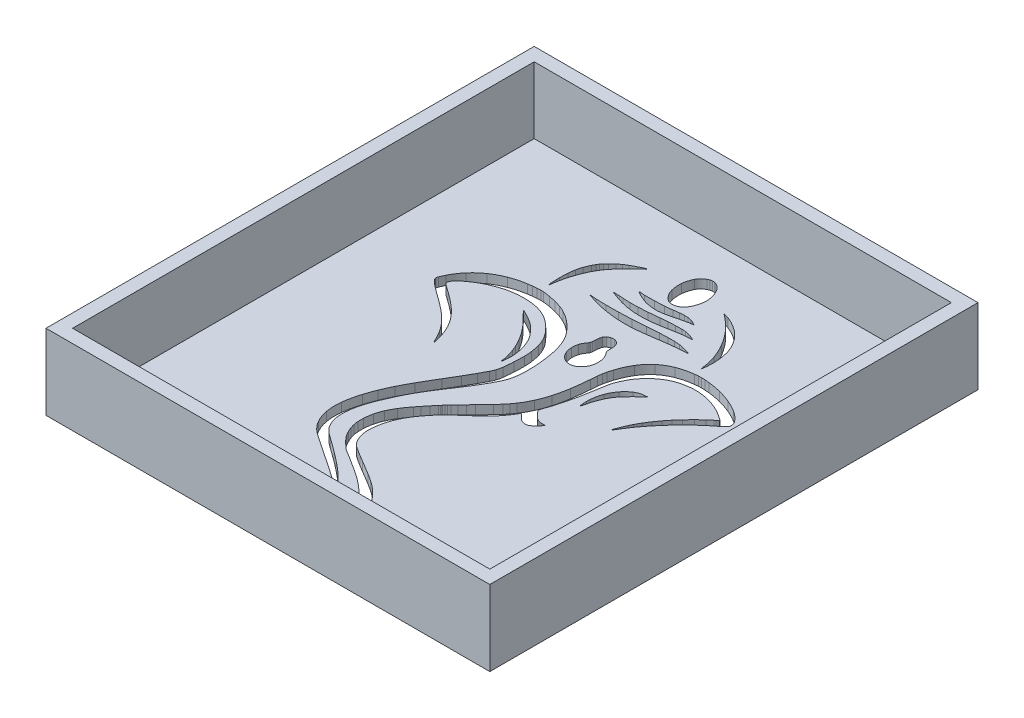
from build123d import *

# Parameters (mm, degrees)
SKETCH1_W           = 100
SKETCH1_H           = 110
BOSS_EXTRUDE1_DEPTH = 2
SKETCH2_W           = 100
SKETCH2_H           = 110
SKETCH2_W_2         = 94
SKETCH2_H_2         = 104
BOSS_EXTRUDE2_DEPTH = 15
CUT_EXTRUDE1_REACH  = 78.25


with BuildPart() as part:
    # Sketch1 → Boss-Extrude1 (new body)
    with BuildSketch(Plane(origin=(0, 0, 0), x_dir=(1, 0, 0), z_dir=(0, 1, 0))):
        Rectangle(SKETCH1_W, SKETCH1_H)
    extrude(amount=BOSS_EXTRUDE1_DEPTH)

    # Sketch2 → Boss-Extrude2 (add)
    with BuildSketch(Plane(origin=(0, 2, 0), x_dir=(1, 0, 0), z_dir=(0, 1, 0))):
        Rectangle(SKETCH2_W, SKETCH2_H)
        Rectangle(SKETCH2_W_2, SKETCH2_H_2, mode=Mode.SUBTRACT)
    extrude(amount=BOSS_EXTRUDE2_DEPTH)

    # Sketch4 → Cut-Extrude1 (cut, up to next)
    with BuildSketch(Plane.XZ, mode=Mode.PRIVATE) as cut_extrude1_sk1:
        with BuildLine():
            Line((9.47406283, -38.48205929), (9.186502871, -38.710567713))
            ThreePointArc((9.186502871, -38.710567713), (9.061127474, -38.810454253), (8.935859828, -38.910475889))
            Line((8.935859828, -38.910475889), (8.720966167, -39.082401533))
            ThreePointArc((8.720966167, -39.082401533), (8.701265352, -39.098574144), (8.681963789, -39.115221219))
            ThreePointArc((8.681963789, -39.115221219), (8.673841503, -39.149940797), (8.703931389, -39.169072429))
            ThreePointArc((8.703931389, -39.169072429), (8.835052241, -39.157032449), (8.964756587, -39.134351582))
            ThreePointArc((8.964756587, -39.134351582), (9.177241087, -39.083197749), (9.387226765, -39.022597482))
            ThreePointArc((9.387226765, -39.022597482), (9.618887581, -38.945980889), (9.847963596, -38.861951041))
            ThreePointArc((9.847963596, -38.861951041), (11.535345038, -38.060130076), (13.082006416, -37.012269601))
            ThreePointArc((13.082006416, -37.012269601), (14.366185015, -35.791117436), (15.414278841, -34.362192449))
            ThreePointArc((15.414278841, -34.362192449), (16.20745254, -32.748508351), (16.708772989, -31.021725594))
            ThreePointArc((16.708772989, -31.021725594), (16.951045093, -29.100879838), (16.92313547, -27.165016919))
            ThreePointArc((16.92313547, -27.165016919), (16.901767061, -26.922364591), (16.878710814, -26.679866815))
            ThreePointArc((16.878710814, -26.679866815), (16.856996364, -26.471223992), (16.8330174, -26.262829284))
            ThreePointArc((16.8330174, -26.262829284), (16.811073616, -26.083560944), (16.788481027, -25.904373214))
            ThreePointArc((16.788481027, -25.904373214), (16.780874967, -25.879048728), (16.765492792, -25.857541276))
            ThreePointArc((16.765492792, -25.857541276), (16.751967667, -25.853842622), (16.741901162, -25.863603488))
            ThreePointArc((16.741901162, -25.863603488), (16.723648308, -25.92995185), (16.707244629, -25.996781418))
            ThreePointArc((16.707244629, -25.996781418), (16.687972911, -26.087141776), (16.671726951, -26.178094854))
            ThreePointArc((16.671726951, -26.178094854), (16.654566841, -26.290792017), (16.63942931, -26.403778631))
            ThreePointArc((16.63942931, -26.403778631), (16.335956708, -28.071664455), (15.848751479, -29.695416224))
            ThreePointArc((15.848751479, -29.695416224), (15.159372662, -31.352193642), (14.317389157, -32.936876053))
            ThreePointArc((14.317389157, -32.936876053), (13.302288717, -34.482580887), (12.150488486, -35.929297364))
            ThreePointArc((12.150488486, -35.929297364), (10.870394389, -37.26661251), (9.47406283, -38.48205929))
        make_face()
    cut_extrude1_tool1 = extrude(cut_extrude1_sk1.sketch, amount=-CUT_EXTRUDE1_REACH, mode=Mode.PRIVATE) & part.part
    # Sketch4 → Cut-Extrude1 (cut, up to next)
    with BuildSketch(Plane.XZ, mode=Mode.PRIVATE) as cut_extrude1_sk2:
        with BuildLine():
            Line((6.941908645, -33.890231102), (7.347396509, -33.63349437))
            Line((7.347396509, -33.63349437), (6.682513669, -33.547278241))
            ThreePointArc((6.682513669, -33.547278241), (6.495755061, -33.519621548), (6.310117562, -33.485235657))
            ThreePointArc((6.310117562, -33.485235657), (5.980249226, -33.4167065), (5.650884261, -33.345797511))
            ThreePointArc((5.650884261, -33.345797511), (5.267883689, -33.260361312), (4.88554578, -33.172006876))
            ThreePointArc((4.88554578, -33.172006876), (4.494561137, -33.078617079), (4.10424883, -32.982456022))
            ThreePointArc((4.10424883, -32.982456022), (3.064972223, -32.730835391), (2.022007288, -32.494969))
            ThreePointArc((2.022007288, -32.494969), (1.377525276, -32.374570327), (0.726958013, -32.293236815))
            ThreePointArc((0.726958013, -32.293236815), (0.180911967, -32.264428695), (-0.365642362, -32.280998453))
            ThreePointArc((-0.365642362, -32.280998453), (-1.010096289, -32.343671348), (-1.650588241, -32.438638787))
            ThreePointArc((-1.650588241, -32.438638787), (-1.939627621, -32.494465595), (-2.226408456, -32.560927228))
            ThreePointArc((-2.226408456, -32.560927228), (-2.505925043, -32.636957254), (-2.782285059, -32.723762949))
            ThreePointArc((-2.782285059, -32.723762949), (-3.072160528, -32.826875564), (-3.358130333, -32.940371246))
            ThreePointArc((-3.358130333, -32.940371246), (-3.678434514, -33.078908573), (-3.995210868, -33.225332956))
            ThreePointArc((-3.995210868, -33.225332956), (-4.424467866, -33.434126517), (-4.850606808, -33.649212371))
            ThreePointArc((-4.850606808, -33.649212371), (-5.063207174, -33.771041314), (-5.263834116, -33.911718382))
            ThreePointArc((-5.263834116, -33.911718382), (-5.282854734, -33.963617278), (-5.244237135, -34.003164216))
            ThreePointArc((-5.244237135, -34.003164216), (-5.125166803, -34.017688038), (-5.005882695, -34.005039454))
            ThreePointArc((-5.005882695, -34.005039454), (-4.504177433, -33.921638979), (-3.996381241, -33.893234125))
            ThreePointArc((-3.996381241, -33.893234125), (-2.921533611, -33.899451845), (-1.846888643, -33.921229742))
            ThreePointArc((-1.846888643, -33.921229742), (-0.734375177, -33.961902929), (0.377220916, -34.022686514))
            ThreePointArc((0.377220916, -34.022686514), (1.208265784, -34.09325946), (2.035604275, -34.198744693))
            ThreePointArc((2.035604275, -34.198744693), (2.720218571, -34.29424366), (3.406484953, -34.377040046))
            ThreePointArc((3.406484953, -34.377040046), (3.924950488, -34.423588025), (4.444926125, -34.448053553))
            ThreePointArc((4.444926125, -34.448053553), (4.858447417, -34.447137789), (5.27127063, -34.423102558))
            ThreePointArc((5.27127063, -34.423102558), (5.622569496, -34.377027368), (5.968415806, -34.300058887))
            ThreePointArc((5.968415806, -34.300058887), (6.092731649, -34.263872269), (6.215501686, -34.222745416))
            ThreePointArc((6.215501686, -34.222745416), (6.352824966, -34.171519866), (6.488681407, -34.116521977))
            ThreePointArc((6.488681407, -34.116521977), (6.618174424, -34.059868444), (6.746037088, -33.99962557))
            ThreePointArc((6.746037088, -33.99962557), (6.845480049, -33.947626957), (6.941908645, -33.890231102))
        make_face()
    cut_extrude1_tool2 = extrude(cut_extrude1_sk2.sketch, amount=-CUT_EXTRUDE1_REACH, mode=Mode.PRIVATE) & part.part
    # Sketch4 → Cut-Extrude1 (cut, up to next)
    with BuildSketch(Plane.XZ, mode=Mode.PRIVATE) as cut_extrude1_sk3:
        with BuildLine():
            Line((6.94346083, -30.262756948), (6.28048446, -30.143500538))
            Line((6.28048446, -30.143500538), (5.45133148, -29.994221067))
            Line((5.45133148, -29.994221067), (4.598784504, -29.840638214))
            Line((4.598784504, -29.840638214), (3.85736083, -29.706973915))
            ThreePointArc((3.85736083, -29.706973915), (2.69248572, -29.523505749), (1.520608375, -29.391983589))
            ThreePointArc((1.520608375, -29.391983589), (0.40620671, -29.321271888), (-0.71036825, -29.308960463))
            ThreePointArc((-0.71036825, -29.308960463), (-1.773760762, -29.354355975), (-2.833045849, -29.45818031))
            ThreePointArc((-2.833045849, -29.45818031), (-3.845116422, -29.617430117), (-4.84544117, -29.838784456))
            ThreePointArc((-4.84544117, -29.838784456), (-5.310482591, -29.964483512), (-5.771442387, -30.104411502))
            ThreePointArc((-5.771442387, -30.104411502), (-6.3177033, -30.284922389), (-6.860600526, -30.475310851))
            ThreePointArc((-6.860600526, -30.475310851), (-7.401400047, -30.672081876), (-7.941167457, -30.871666698))
            ThreePointArc((-7.941167457, -30.871666698), (-7.976140931, -30.912014374), (-7.961100577, -30.963247826))
            ThreePointArc((-7.961100577, -30.963247826), (-7.9398499, -30.977133634), (-7.914811792, -30.981316942))
            ThreePointArc((-7.914811792, -30.981316942), (-7.627069225, -30.969256666), (-7.339346849, -30.956723934))
            ThreePointArc((-7.339346849, -30.956723934), (-7.011133907, -30.940865489), (-6.683055712, -30.922428475))
            ThreePointArc((-6.683055712, -30.922428475), (-6.298052402, -30.898332645), (-5.913171159, -30.872359836))
            ThreePointArc((-5.913171159, -30.872359836), (-5.082695328, -30.827375052), (-4.251216442, -30.808491268))
            ThreePointArc((-4.251216442, -30.808491268), (-3.335250163, -30.812854114), (-2.419640164, -30.838769118))
            ThreePointArc((-2.419640164, -30.838769118), (-1.371504372, -30.891418534), (-0.324649943, -30.96528601))
            ThreePointArc((-0.324649943, -30.96528601), (0.910502777, -31.072693073), (2.144236106, -31.195333162))
            ThreePointArc((2.144236106, -31.195333162), (2.978547054, -31.276250598), (3.814121483, -31.342867135))
            ThreePointArc((3.814121483, -31.342867135), (4.630895387, -31.39339928), (5.448461037, -31.428888963))
            ThreePointArc((5.448461037, -31.428888963), (6.154965004, -31.446493477), (6.861673872, -31.451004573))
            ThreePointArc((6.861673872, -31.451004573), (7.304875913, -31.43430962), (7.74584683, -31.386860478))
            ThreePointArc((7.74584683, -31.386860478), (8.064998505, -31.331979524), (8.380529342, -31.259109764))
            ThreePointArc((8.380529342, -31.259109764), (8.746751357, -31.15662206), (9.109146565, -31.041331094))
            ThreePointArc((9.109146565, -31.041331094), (9.444688504, -30.9236185), (9.777354862, -30.798009021))
            ThreePointArc((9.777354862, -30.798009021), (9.888306215, -30.732411602), (9.972777824, -30.635057756))
            ThreePointArc((9.972777824, -30.635057756), (9.975355907, -30.607064489), (9.954580327, -30.588126569))
            ThreePointArc((9.954580327, -30.588126569), (9.871622097, -30.567334672), (9.787508625, -30.551865511))
            ThreePointArc((9.787508625, -30.551865511), (9.66163943, -30.536122937), (9.535129466, -30.526843289))
            ThreePointArc((9.535129466, -30.526843289), (9.369411273, -30.520881849), (9.203599124, -30.518786716))
            ThreePointArc((9.203599124, -30.518786716), (8.993519302, -30.514285601), (8.783799163, -30.501199156))
            ThreePointArc((8.783799163, -30.501199156), (8.488163985, -30.474437747), (8.19296396, -30.443240346))
            ThreePointArc((8.19296396, -30.443240346), (7.87046788, -30.404279393), (7.548586157, -30.360532002))
            ThreePointArc((7.548586157, -30.360532002), (7.245591279, -30.314319431), (6.94346083, -30.262756948))
        make_face()
    cut_extrude1_tool3 = extrude(cut_extrude1_sk3.sketch, amount=-CUT_EXTRUDE1_REACH, mode=Mode.PRIVATE) & part.part
    # Sketch4 → Cut-Extrude1 (cut, up to next)
    with BuildSketch(Plane.XZ, mode=Mode.PRIVATE) as cut_extrude1_sk4:
        with BuildLine():
            Line((-8.98081517, -27.361707774), (-10.27697717, -27.791851725))
            Line((-10.27697717, -27.791851725), (-8.73392717, -27.706224548))
            ThreePointArc((-8.73392717, -27.706224548), (-7.588149664, -27.657161512), (-6.441498024, -27.637079366))
            ThreePointArc((-6.441498024, -27.637079366), (-5.069143892, -27.640574258), (-3.696992631, -27.664427891))
            ThreePointArc((-3.696992631, -27.664427891), (-2.197363992, -27.71204413), (-0.698540957, -27.78047562))
            ThreePointArc((-0.698540957, -27.78047562), (0.839391414, -27.871285699), (2.37603283, -27.981809945))
            ThreePointArc((2.37603283, -27.981809945), (3.728352222, -28.083307861), (5.08131204, -28.175878356))
            ThreePointArc((5.08131204, -28.175878356), (6.009298951, -28.227155003), (6.938113483, -28.260209001))
            ThreePointArc((6.938113483, -28.260209001), (7.644529739, -28.268485621), (8.350899819, -28.25692107))
            ThreePointArc((8.350899819, -28.25692107), (8.964133777, -28.225165802), (9.575456152, -28.167293196))
            ThreePointArc((9.575456152, -28.167293196), (9.945510152, -28.115235046), (10.312633352, -28.045445574))
            ThreePointArc((10.312633352, -28.045445574), (10.745895422, -27.945707775), (11.176115862, -27.833573822))
            ThreePointArc((11.176115862, -27.833573822), (11.584898052, -27.717262802), (11.991796287, -27.594523405))
            ThreePointArc((11.991796287, -27.594523405), (12.09954161, -27.538438244), (12.180786458, -27.448139436))
            ThreePointArc((12.180786458, -27.448139436), (12.182368713, -27.420372292), (12.159968245, -27.403887848))
            ThreePointArc((12.159968245, -27.403887848), (11.962791957, -27.377739524), (11.765319999, -27.353926729))
            ThreePointArc((11.765319999, -27.353926729), (11.519349455, -27.328578614), (11.272864973, -27.308844486))
            ThreePointArc((11.272864973, -27.308844486), (10.973971428, -27.290279787), (10.674862982, -27.27557818))
            ThreePointArc((10.674862982, -27.27557818), (10.276727207, -27.253317169), (9.879318002, -27.220551782))
            ThreePointArc((9.879318002, -27.220551782), (9.305001933, -27.162926591), (8.731232388, -27.100092535))
            ThreePointArc((8.731232388, -27.100092535), (8.0986323, -27.025021236), (7.466734267, -26.944253373))
            ThreePointArc((7.466734267, -26.944253373), (6.865179481, -26.861421788), (6.26451883, -26.772337481))
            ThreePointArc((6.26451883, -26.772337481), (5.137896613, -26.604267575), (4.009854536, -26.446007712))
            ThreePointArc((4.009854536, -26.446007712), (3.116475992, -26.332537437), (2.221258249, -26.234629737))
            ThreePointArc((2.221258249, -26.234629737), (1.46971876, -26.167183849), (0.71690498, -26.115881176))
            ThreePointArc((0.71690498, -26.115881176), (0.034560243, -26.086621327), (-0.64834517, -26.077098898))
            ThreePointArc((-0.64834517, -26.077098898), (-1.718551152, -26.098685081), (-2.787082093, -26.162312415))
            ThreePointArc((-2.787082093, -26.162312415), (-3.874943285, -26.268813437), (-4.958132334, -26.415394218))
            ThreePointArc((-4.958132334, -26.415394218), (-6.011663388, -26.598173313), (-7.057571476, -26.820461754))
            ThreePointArc((-7.057571476, -26.820461754), (-8.025431725, -27.068917458), (-8.98081517, -27.361707774))
        make_face()
    cut_extrude1_tool4 = extrude(cut_extrude1_sk4.sketch, amount=-CUT_EXTRUDE1_REACH, mode=Mode.PRIVATE) & part.part
    # Sketch4 → Cut-Extrude1 (cut, up to next)
    with BuildSketch(Plane.XZ, mode=Mode.PRIVATE) as cut_extrude1_sk5:
        with BuildLine():
            Line((9.500274065, 2.722100405), (10.146128629, 2.722100405))
            Line((10.146128629, 2.722100405), (9.933539668, 3.085208586))
            ThreePointArc((9.933539668, 3.085208586), (9.77824677, 3.320265649), (9.598449819, 3.537154476))
            ThreePointArc((9.598449819, 3.537154476), (9.351102315, 3.790209772), (9.090140386, 4.029200655))
            ThreePointArc((9.090140386, 4.029200655), (8.826844355, 4.245096684), (8.552272782, 4.446457916))
            ThreePointArc((8.552272782, 4.446457916), (8.353574149, 4.560664887), (8.138562313, 4.640001443))
            ThreePointArc((8.138562313, 4.640001443), (7.839755503, 4.698629182), (7.535525535, 4.711546129))
            ThreePointArc((7.535525535, 4.711546129), (7.249203136, 4.676413874), (6.973602645, 4.591213165))
            ThreePointArc((6.973602645, 4.591213165), (6.678020775, 4.444161372), (6.406958639, 4.255698669))
            ThreePointArc((6.406958639, 4.255698669), (6.085417649, 3.976479094), (5.783933685, 3.67571407))
            ThreePointArc((5.783933685, 3.67571407), (5.669540218, 3.554779141), (5.553803085, 3.435129491))
            ThreePointArc((5.553803085, 3.435129491), (5.455080683, 3.336078035), (5.354519165, 3.238894267))
            ThreePointArc((5.354519165, 3.238894267), (5.269081654, 3.158428686), (5.183081866, 3.078564336))
            ThreePointArc((5.183081866, 3.078564336), (5.169142982, 3.073521822), (5.155786052, 3.079949254))
            ThreePointArc((5.155786052, 3.079949254), (5.14352326, 3.095045829), (5.132580061, 3.111124666))
            ThreePointArc((5.132580061, 3.111124666), (5.071961931, 3.208968272), (5.011464586, 3.306886605))
            ThreePointArc((5.011464586, 3.306886605), (4.941489641, 3.420731503), (4.871899663, 3.534812126))
            ThreePointArc((4.871899663, 3.534812126), (4.792237884, 3.666230846), (4.712869104, 3.797826726))
            ThreePointArc((4.712869104, 3.797826726), (4.243310058, 4.534993393), (3.736689135, 5.247198161))
            ThreePointArc((3.736689135, 5.247198161), (3.186447696, 5.944248831), (2.602895991, 6.613661025))
            ThreePointArc((2.602895991, 6.613661025), (1.877039122, 7.376259816), (1.122196198, 8.110178933))
            ThreePointArc((1.122196198, 8.110178933), (0.090498074, 9.059044782), (-0.95695517, 9.990489421))
            ThreePointArc((-0.95695517, 9.990489421), (-1.74077707, 10.685169666), (-2.515199151, 11.39031352))
            ThreePointArc((-2.515199151, 11.39031352), (-3.075737096, 11.924721358), (-3.618651859, 12.477023888))
            ThreePointArc((-3.618651859, 12.477023888), (-4.106053005, 13.00818697), (-4.573853877, 13.556690788))
            ThreePointArc((-4.573853877, 13.556690788), (-5.113864507, 14.22815144), (-5.639398908, 14.911001702))
            ThreePointArc((-5.639398908, 14.911001702), (-6.296031054, 15.841724672), (-6.894045456, 16.811152233))
            ThreePointArc((-6.894045456, 16.811152233), (-7.401708343, 17.771370337), (-7.839860669, 18.765232979))
            ThreePointArc((-7.839860669, 18.765232979), (-8.192833273, 19.754296338), (-8.471952338, 20.766683879))
            ThreePointArc((-8.471952338, 20.766683879), (-8.670753531, 21.781282312), (-8.790613272, 22.808202726))
            ThreePointArc((-8.790613272, 22.808202726), (-8.815153982, 23.547132576), (-8.77415004, 24.285331902))
            ThreePointArc((-8.77415004, 24.285331902), (-8.668128921, 24.986428272), (-8.49230023, 25.67334957))
            ThreePointArc((-8.49230023, 25.67334957), (-8.26289165, 26.292313658), (-7.967984308, 26.88288499))
            ThreePointArc((-7.967984308, 26.88288499), (-7.634013699, 27.383210334), (-7.232283621, 27.830954414))
            ThreePointArc((-7.232283621, 27.830954414), (-7.052873144, 27.989205808), (-6.859867269, 28.130557693))
            ThreePointArc((-6.859867269, 28.130557693), (-6.371486988, 28.452249994), (-5.880349375, 28.769716654))
            ThreePointArc((-5.880349375, 28.769716654), (-5.284266634, 29.146844393), (-4.684132451, 29.517491029))
            ThreePointArc((-4.684132451, 29.517491029), (-4.017914915, 29.920302062), (-3.348469235, 30.31772503))
            ThreePointArc((-3.348469235, 30.31772503), (-1.884821275, 31.185854537), (-0.427531999, 32.064616255))
            ThreePointArc((-0.427531999, 32.064616255), (0.492727106, 32.640751627), (1.397590256, 33.240777849))
            ThreePointArc((1.397590256, 33.240777849), (2.059340891, 33.711767599), (2.701796855, 34.208754099))
            ThreePointArc((2.701796855, 34.208754099), (3.271659005, 34.692551459), (3.81606659, 35.204823982))
            ThreePointArc((3.81606659, 35.204823982), (5.211414962, 36.764936236), (6.40809704, 38.482172192))
            ThreePointArc((6.40809704, 38.482172192), (7.136841266, 40.033622565), (7.512978118, 41.705922621))
            ThreePointArc((7.512978118, 41.705922621), (7.488970135, 43.247675815), (7.075755024, 44.733216985))
            ThreePointArc((7.075755024, 44.733216985), (6.276552993, 46.190277347), (5.197401987, 47.454073964))
            ThreePointArc((5.197401987, 47.454073964), (4.925396857, 47.698130174), (4.63914489, 47.925308596))
            ThreePointArc((4.63914489, 47.925308596), (4.254932619, 48.20343114), (3.86305777, 48.470648883))
            ThreePointArc((3.86305777, 48.470648883), (3.467297571, 48.724561678), (3.064590624, 48.967306313))
            ThreePointArc((3.064590624, 48.967306313), (2.757089817, 49.13337953), (2.439222579, 49.278629242))
            ThreePointArc((2.439222579, 49.278629242), (2.207998954, 49.369506515), (1.973187532, 49.450664627))
            ThreePointArc((1.973187532, 49.450664627), (1.736978726, 49.521303574), (1.497971461, 49.58180141))
            ThreePointArc((1.497971461, 49.58180141), (1.293018808, 49.625963343), (1.086883437, 49.664226574))
            ThreePointArc((1.086883437, 49.664226574), (1.039042899, 49.651201818), (1.01814883, 49.606237397))
            ThreePointArc((1.01814883, 49.606237397), (1.024303602, 49.577735031), (1.041671084, 49.554312036))
            ThreePointArc((1.041671084, 49.554312036), (1.146454311, 49.463303444), (1.252131747, 49.373334738))
            ThreePointArc((1.252131747, 49.373334738), (1.379712041, 49.267999032), (1.509404967, 49.165275678))
            ThreePointArc((1.509404967, 49.165275678), (1.661285969, 49.049063756), (1.8146863, 48.93486486))
            ThreePointArc((1.8146863, 48.93486486), (2.382593969, 48.484308113), (2.915306708, 47.992639892))
            ThreePointArc((2.915306708, 47.992639892), (3.429816586, 47.445358659), (3.906455743, 46.864796625))
            ThreePointArc((3.906455743, 46.864796625), (4.321816466, 46.281780316), (4.695595955, 45.671271151))
            ThreePointArc((4.695595955, 45.671271151), (4.971553589, 45.115928807), (5.186774446, 44.534346726))
            ThreePointArc((5.186774446, 44.534346726), (5.295037052, 44.111209757), (5.360015632, 43.679302972))
            ThreePointArc((5.360015632, 43.679302972), (5.396626931, 43.154338223), (5.402619737, 42.628132502))
            ThreePointArc((5.402619737, 42.628132502), (5.378189063, 42.107805649), (5.32344399, 41.589790333))
            ThreePointArc((5.32344399, 41.589790333), (5.244318869, 41.178098202), (5.120156534, 40.777679785))
            ThreePointArc((5.120156534, 40.777679785), (4.721862865, 39.88663656), (4.212629946, 39.054003561))
            ThreePointArc((4.212629946, 39.054003561), (3.493791176, 38.106453836), (2.70895994, 37.212798651))
            ThreePointArc((2.70895994, 37.212798651), (1.736333799, 36.245117047), (0.704777595, 35.340517084))
            ThreePointArc((0.704777595, 35.340517084), (-0.491293503, 34.402041264), (-1.729529074, 33.519943986))
            ThreePointArc((-1.729529074, 33.519943986), (-2.251130591, 33.171153389), (-2.777172872, 32.829097047))
            ThreePointArc((-2.777172872, 32.829097047), (-3.615002739, 32.293986616), (-4.454687582, 31.761791705))
            ThreePointArc((-4.454687582, 31.761791705), (-5.294891136, 31.233335984), (-6.136911804, 30.707780418))
            ThreePointArc((-6.136911804, 30.707780418), (-6.661771629, 30.386278685), (-7.19087717, 30.071813225))
            ThreePointArc((-7.19087717, 30.071813225), (-7.327138978, 29.98449226), (-7.455920696, 29.886474403))
            ThreePointArc((-7.455920696, 29.886474403), (-7.680897082, 29.697501119), (-7.902925617, 29.505072933))
            ThreePointArc((-7.902925617, 29.505072933), (-8.159232727, 29.275690612), (-8.411747959, 29.042140527))
            ThreePointArc((-8.411747959, 29.042140527), (-8.668457963, 28.797145943), (-8.92148428, 28.548348726))
            ThreePointArc((-8.92148428, 28.548348726), (-9.267700206, 28.19682091), (-9.607832674, 27.839403539))
            ThreePointArc((-9.607832674, 27.839403539), (-9.831255076, 27.587823084), (-10.041375285, 27.325030784))
            ThreePointArc((-10.041375285, 27.325030784), (-10.21920866, 27.075062357), (-10.38159201, 26.814792169))
            ThreePointArc((-10.38159201, 26.814792169), (-10.56918273, 26.480856613), (-10.746186456, 26.141190726))
            ThreePointArc((-10.746186456, 26.141190726), (-11.003012618, 25.594615334), (-11.231737136, 25.035697243))
            ThreePointArc((-11.231737136, 25.035697243), (-11.397142023, 24.542278462), (-11.523018437, 24.037326981))
            ThreePointArc((-11.523018437, 24.037326981), (-11.609623026, 23.519351949), (-11.655532979, 22.996197322))
            ThreePointArc((-11.655532979, 22.996197322), (-11.670675721, 22.377570175), (-11.656128967, 21.758928726))
            ThreePointArc((-11.656128967, 21.758928726), (-11.564746575, 20.789514119), (-11.383759286, 19.832770149))
            ThreePointArc((-11.383759286, 19.832770149), (-11.112374669, 18.880701847), (-10.757931536, 17.956335185))
            ThreePointArc((-10.757931536, 17.956335185), (-10.282746598, 16.971448499), (-9.731996722, 16.026738445))
            ThreePointArc((-9.731996722, 16.026738445), (-9.017714826, 14.963157752), (-8.252312503, 13.935752378))
            ThreePointArc((-8.252312503, 13.935752378), (-7.880487094, 13.464109719), (-7.505954031, 12.994614334))
            ThreePointArc((-7.505954031, 12.994614334), (-7.060053565, 12.440922367), (-6.612225643, 11.888788169))
            ThreePointArc((-6.612225643, 11.888788169), (-6.170509053, 11.346886289), (-5.728046143, 10.805593609))
            ThreePointArc((-5.728046143, 10.805593609), (-5.630593278, 10.693452378), (-5.526703547, 10.587246726))
            ThreePointArc((-5.526703547, 10.587246726), (-5.503795454, 10.564511597), (-5.481563656, 10.541114716))
            Line((-5.481563656, 10.541114716), (-5.283452701, 10.326085514))
            ThreePointArc((-5.283452701, 10.326085514), (-5.167373622, 10.19970491), (-5.051495129, 10.073140364))
            ThreePointArc((-5.051495129, 10.073140364), (-4.919943241, 9.929071672), (-4.788547312, 9.784860726))
            ThreePointArc((-4.788547312, 9.784860726), (-4.589930262, 9.568529988), (-4.38944212, 9.353932165))
            ThreePointArc((-4.38944212, 9.353932165), (-3.994930082, 8.9358941), (-3.599839857, 8.518402439))
            ThreePointArc((-3.599839857, 8.518402439), (-3.133657866, 8.027225134), (-2.666722958, 7.53676353))
            ThreePointArc((-2.666722958, 7.53676353), (-2.177960673, 7.024850938), (-1.688511842, 6.513594726))
            ThreePointArc((-1.688511842, 6.513594726), (-0.714366224, 5.493620928), (0.255976318, 4.470028437))
            ThreePointArc((0.255976318, 4.470028437), (0.788838651, 3.894973059), (1.310675064, 3.309893825))
            ThreePointArc((1.310675064, 3.309893825), (1.677970109, 2.87610351), (2.030983889, 2.43061394))
            ThreePointArc((2.030983889, 2.43061394), (2.366119943, 1.977827506), (2.685964174, 1.514112726))
            ThreePointArc((2.685964174, 1.514112726), (3.439210878, 0.271774723), (4.085369798, -1.029479656))
            ThreePointArc((4.085369798, -1.029479656), (4.657272927, -2.449590793), (5.125609055, -3.907140142))
            ThreePointArc((5.125609055, -3.907140142), (5.544081143, -5.588796224), (5.857444094, -7.29316993))
            ThreePointArc((5.857444094, -7.29316993), (6.129024493, -9.33513923), (6.324588655, -11.385785274))
            ThreePointArc((6.324588655, -11.385785274), (6.383493942, -12.098032417), (6.450954451, -12.809520229))
            ThreePointArc((6.450954451, -12.809520229), (6.508765311, -13.295175475), (6.583957708, -13.778444776))
            ThreePointArc((6.583957708, -13.778444776), (6.67048138, -14.221454456), (6.775168884, -14.660526716))
            ThreePointArc((6.775168884, -14.660526716), (6.925114285, -15.213381248), (7.086306647, -15.763061864))
            ThreePointArc((7.086306647, -15.763061864), (7.721509369, -17.463994478), (8.562067569, -19.073378263))
            ThreePointArc((8.562067569, -19.073378263), (9.528622115, -20.41161164), (10.701248767, -21.573525147))
            ThreePointArc((10.701248767, -21.573525147), (12.043235043, -22.523245503), (13.523270819, -23.23905974))
            ThreePointArc((13.523270819, -23.23905974), (15.237995178, -23.777672455), (17.007086525, -24.095003647))
            ThreePointArc((17.007086525, -24.095003647), (17.436008482, -24.13984607), (17.865733363, -24.176197334))
            ThreePointArc((17.865733363, -24.176197334), (18.207922333, -24.195043314), (18.550585738, -24.200543576))
            ThreePointArc((18.550585738, -24.200543576), (18.912873884, -24.192862101), (19.274660469, -24.172315267))
            ThreePointArc((19.274660469, -24.172315267), (19.775340761, -24.131486265), (20.27541283, -24.083782094))
            ThreePointArc((20.27541283, -24.083782094), (21.751309135, -23.876663417), (23.207570385, -23.559691457))
            ThreePointArc((23.207570385, -23.559691457), (24.655705163, -23.131084676), (26.069265117, -22.599439715))
            ThreePointArc((26.069265117, -22.599439715), (27.338673464, -22.01136874), (28.559628447, -21.328365116))
            ThreePointArc((28.559628447, -21.328365116), (29.507689687, -20.659495275), (30.359021517, -19.871179923))
            ThreePointArc((30.359021517, -19.871179923), (30.606699897, -19.590594283), (30.834536816, -19.293671364))
            ThreePointArc((30.834536816, -19.293671364), (30.995425317, -19.03528679), (31.122439332, -18.758673092))
            ThreePointArc((31.122439332, -18.758673092), (31.193418057, -18.517687912), (31.224703674, -18.268422899))
            ThreePointArc((31.224703674, -18.268422899), (31.209937073, -18.041991689), (31.146464373, -17.824137697))
            ThreePointArc((31.146464373, -17.824137697), (31.090769612, -17.717209057), (31.017309113, -17.621609916))
            ThreePointArc((31.017309113, -17.621609916), (30.866410021, -17.46266462), (30.71027179, -17.308862814))
            ThreePointArc((30.71027179, -17.308862814), (30.507975432, -17.122303441), (30.29975704, -16.942377576))
            ThreePointArc((30.29975704, -16.942377576), (30.052645358, -16.740039367), (29.801390775, -16.542869216))
            ThreePointArc((29.801390775, -16.542869216), (28.295234263, -15.326259685), (26.850359866, -14.037467938))
            ThreePointArc((26.850359866, -14.037467938), (25.37553866, -12.598448126), (23.960323626, -11.100769249))
            ThreePointArc((23.960323626, -11.100769249), (22.633943125, -9.576873829), (21.371420506, -7.999667717))
            ThreePointArc((21.371420506, -7.999667717), (20.308443304, -6.529593827), (19.330624547, -5.001553168))
            ThreePointArc((19.330624547, -5.001553168), (19.181424691, -4.755731652), (19.029944219, -4.511308901))
            ThreePointArc((19.029944219, -4.511308901), (18.905349902, -4.316194439), (18.777328788, -4.123311077))
            ThreePointArc((18.777328788, -4.123311077), (18.677801688, -3.978117855), (18.576504657, -3.834153877))
            ThreePointArc((18.576504657, -3.834153877), (18.558428335, -3.828144708), (18.54719683, -3.843530312))
            ThreePointArc((18.54719683, -3.843530312), (18.563766467, -4.025927356), (18.612932612, -4.202352764))
            ThreePointArc((18.612932612, -4.202352764), (18.83725581, -4.786717687), (19.066421428, -5.369200632))
            ThreePointArc((19.066421428, -5.369200632), (19.306568735, -5.958971383), (19.555778873, -6.544970167))
            ThreePointArc((19.555778873, -6.544970167), (19.760682878, -6.996637555), (19.980007264, -7.44148123))
            ThreePointArc((19.980007264, -7.44148123), (20.315761602, -8.069116186), (20.672744008, -8.684924741))
            ThreePointArc((20.672744008, -8.684924741), (21.082126806, -9.344322064), (21.508742204, -9.992703439))
            ThreePointArc((21.508742204, -9.992703439), (21.969077241, -10.654310149), (22.44613866, -11.303959431))
            ThreePointArc((22.44613866, -11.303959431), (22.937097403, -11.937701564), (23.444320053, -12.558503274))
            ThreePointArc((23.444320053, -12.558503274), (23.998248818, -13.201034776), (24.569282013, -13.828414166))
            ThreePointArc((24.569282013, -13.828414166), (25.2384706, -14.531218631), (25.920226485, -15.221838928))
            ThreePointArc((25.920226485, -15.221838928), (26.573318551, -15.860136507), (27.237662947, -16.48671417))
            ThreePointArc((27.237662947, -16.48671417), (27.716213036, -16.908230196), (28.215343007, -17.305162456))
            ThreePointArc((28.215343007, -17.305162456), (28.350109393, -17.40768745), (28.484122937, -17.511194566))
            ThreePointArc((28.484122937, -17.511194566), (28.59785222, -17.600769088), (28.710530096, -17.691662658))
            ThreePointArc((28.710530096, -17.691662658), (28.807291547, -17.770925681), (28.9037839, -17.850516075))
            ThreePointArc((28.9037839, -17.850516075), (28.913156941, -17.862604324), (28.91649283, -17.877532535))
            ThreePointArc((28.91649283, -17.877532535), (28.900228196, -17.943709021), (28.855140421, -17.994806557))
            ThreePointArc((28.855140421, -17.994806557), (28.485852717, -18.249570376), (28.115095123, -18.502190283))
            ThreePointArc((28.115095123, -18.502190283), (27.737007898, -18.753154719), (27.354360486, -18.997109745))
            ThreePointArc((27.354360486, -18.997109745), (27.018711665, -19.200201353), (26.677424574, -19.393668287))
            ThreePointArc((26.677424574, -19.393668287), (25.775834516, -19.845077059), (24.843109938, -20.228038381))
            ThreePointArc((24.843109938, -20.228038381), (23.870046734, -20.54692943), (22.876757624, -20.795767212))
            ThreePointArc((22.876757624, -20.795767212), (21.897892983, -20.967082186), (20.909120875, -21.06635214))
            ThreePointArc((20.909120875, -21.06635214), (19.989187244, -21.082353054), (19.071684092, -21.013637108))
            ThreePointArc((19.071684092, -21.013637108), (18.077760133, -20.856955663), (17.097467161, -20.630108574))
            ThreePointArc((17.097467161, -20.630108574), (16.226775555, -20.350999137), (15.38632754, -19.990925417))
            ThreePointArc((15.38632754, -19.990925417), (14.599194728, -19.560425095), (13.85737756, -19.055830328))
            ThreePointArc((13.85737756, -19.055830328), (13.117628152, -18.45048192), (12.42870645, -17.787863801))
            ThreePointArc((12.42870645, -17.787863801), (12.083930481, -17.419144278), (11.748812327, -17.041625564))
            ThreePointArc((11.748812327, -17.041625564), (11.487941352, -16.724983428), (11.242500341, -16.396236384))
            ThreePointArc((11.242500341, -16.396236384), (11.015107847, -16.058962188), (10.804306484, -15.711077127))
            ThreePointArc((10.804306484, -15.711077127), (10.564841275, -15.279840191), (10.337255986, -14.842217274))
            ThreePointArc((10.337255986, -14.842217274), (10.094974619, -14.338205035), (9.870778763, -13.825891835))
            ThreePointArc((9.870778763, -13.825891835), (9.702734481, -13.386171622), (9.561071099, -12.937257117))
            ThreePointArc((9.561071099, -12.937257117), (9.425072668, -12.410724629), (9.313678954, -11.878443241))
            ThreePointArc((9.313678954, -11.878443241), (9.167899134, -11.059549997), (9.033418609, -10.238725479))
            ThreePointArc((9.033418609, -10.238725479), (8.79700534, -8.810274147), (8.536304436, -7.386055244))
            ThreePointArc((8.536304436, -7.386055244), (8.267924786, -6.062387449), (7.971847241, -4.744638553))
            ThreePointArc((7.971847241, -4.744638553), (7.682999647, -3.579558324), (7.367384191, -2.421442718))
            ThreePointArc((7.367384191, -2.421442718), (7.077542966, -1.478415388), (6.749100227, -0.548128418))
            ThreePointArc((6.749100227, -0.548128418), (6.689294395, -0.38103182), (6.634963534, -0.212075706))
            ThreePointArc((6.634963534, -0.212075706), (6.588991921, -0.049694891), (6.549204025, 0.114310724))
            ThreePointArc((6.549204025, 0.114310724), (6.520918274, 0.253279165), (6.497725655, 0.393187755))
            ThreePointArc((6.497725655, 0.393187755), (6.494021629, 0.470241621), (6.505391404, 0.546541989))
            ThreePointArc((6.505391404, 0.546541989), (6.580963609, 0.748996084), (6.699386983, 0.929757593))
            ThreePointArc((6.699386983, 0.929757593), (6.970240616, 1.244903177), (7.252640894, 1.54974496))
            ThreePointArc((7.252640894, 1.54974496), (7.553804123, 1.84999796), (7.867359178, 2.137285937))
            ThreePointArc((7.867359178, 2.137285937), (8.098432863, 2.316032575), (8.349905477, 2.464716579))
            ThreePointArc((8.349905477, 2.464716579), (8.47591186, 2.523607782), (8.605682803, 2.5736606))
            ThreePointArc((8.605682803, 2.5736606), (8.747369222, 2.618299816), (8.89135876, 2.654833548))
            ThreePointArc((8.89135876, 2.654833548), (9.041944056, 2.684198417), (9.193917041, 2.705232647))
            ThreePointArc((9.193917041, 2.705232647), (9.346863545, 2.717880314), (9.500274065, 2.722100405))
        make_face()
    cut_extrude1_tool5 = extrude(cut_extrude1_sk5.sketch, amount=-CUT_EXTRUDE1_REACH, mode=Mode.PRIVATE) & part.part
    # Sketch4 → Cut-Extrude1 (cut, up to next)
    with BuildSketch(Plane.XZ, mode=Mode.PRIVATE) as cut_extrude1_sk6:
        with BuildLine():
            Line((15.429868831, -14.310341888), (16.14003883, -14.377923774))
            Line((16.14003883, -14.377923774), (14.706231585, -12.974437586))
            ThreePointArc((14.706231585, -12.974437586), (14.411651754, -12.682620723), (14.120580043, -12.387304592))
            ThreePointArc((14.120580043, -12.387304592), (13.831767647, -12.087237711), (13.546513596, -11.783786135))
            ThreePointArc((13.546513596, -11.783786135), (13.299809818, -11.515111328), (13.056242418, -11.243590007))
            ThreePointArc((13.056242418, -11.243590007), (12.910013047, -11.070998041), (12.77168721, -10.892009274))
            ThreePointArc((12.77168721, -10.892009274), (12.411502682, -10.368655217), (12.086281682, -9.822886343))
            ThreePointArc((12.086281682, -9.822886343), (11.765436591, -9.206189438), (11.475786417, -8.57424053))
            ThreePointArc((11.475786417, -8.57424053), (11.21207371, -7.914478403), (10.981044098, -7.242573814))
            ThreePointArc((10.981044098, -7.242573814), (10.793580582, -6.587690157), (10.642855064, -5.923388274))
            ThreePointArc((10.642855064, -5.923388274), (10.609539241, -5.763333516), (10.573045877, -5.60397322))
            ThreePointArc((10.573045877, -5.60397322), (10.53839763, -5.46885341), (10.499456711, -5.334907642))
            ThreePointArc((10.499456711, -5.334907642), (10.465116033, -5.227235596), (10.428657874, -5.12026198))
            ThreePointArc((10.428657874, -5.12026198), (10.412186198, -5.098434131), (10.386128577, -5.090141274))
            ThreePointArc((10.386128577, -5.090141274), (10.311184528, -5.118507522), (10.273805277, -5.189388028))
            ThreePointArc((10.273805277, -5.189388028), (10.234017915, -5.539846927), (10.201536345, -5.89105829))
            ThreePointArc((10.201536345, -5.89105829), (10.176861617, -6.282686858), (10.166995726, -6.674967933))
            ThreePointArc((10.166995726, -6.674967933), (10.172749483, -7.050219794), (10.194695202, -7.424873568))
            ThreePointArc((10.194695202, -7.424873568), (10.384365533, -8.701438189), (10.743879782, -9.940930655))
            ThreePointArc((10.743879782, -9.940930655), (11.256850936, -11.07497173), (11.933724279, -12.119496043))
            ThreePointArc((11.933724279, -12.119496043), (12.688597783, -12.955962188), (13.57284272, -13.654260482))
            ThreePointArc((13.57284272, -13.654260482), (14.46101333, -14.096489721), (15.429868831, -14.310341888))
        make_face()
    cut_extrude1_tool6 = extrude(cut_extrude1_sk6.sketch, amount=-CUT_EXTRUDE1_REACH, mode=Mode.PRIVATE) & part.part
    # Sketch4 → Cut-Extrude1 (cut, up to next)
    with BuildSketch(Plane.XZ, mode=Mode.PRIVATE) as cut_extrude1_sk7:
        with BuildLine():
            ThreePointArc((1.728895806, -44.160897692), (2.004730799, -44.026942601), (2.268320039, -43.87025941))
            ThreePointArc((2.268320039, -43.87025941), (2.49759365, -43.70261612), (2.707866967, -43.511682118))
            ThreePointArc((2.707866967, -43.511682118), (2.906486063, -43.29013482), (3.082119054, -43.049956131))
            ThreePointArc((3.082119054, -43.049956131), (3.263531589, -42.754170623), (3.425963552, -42.447551262))
            ThreePointArc((3.425963552, -42.447551262), (3.617067478, -42.01844129), (3.77620035, -41.576476577))
            ThreePointArc((3.77620035, -41.576476577), (3.903145895, -41.122438389), (3.996832922, -40.660390135))
            ThreePointArc((3.996832922, -40.660390135), (4.054509658, -40.206583854), (4.078162644, -39.749738933))
            ThreePointArc((4.078162644, -39.749738933), (4.064924969, -39.32090847), (4.012991989, -38.895028478))
            ThreePointArc((4.012991989, -38.895028478), (3.839991151, -38.112771002), (3.588136255, -37.352228328))
            ThreePointArc((3.588136255, -37.352228328), (3.289979191, -36.740898388), (2.894991282, -36.187177805))
            ThreePointArc((2.894991282, -36.187177805), (2.472641345, -35.780051925), (1.977067006, -35.466145845))
            ThreePointArc((1.977067006, -35.466145845), (1.450156655, -35.275259976), (0.893492363, -35.210477274))
            ThreePointArc((0.893492363, -35.210477274), (0.637566216, -35.221144377), (0.383415459, -35.253071996))
            ThreePointArc((0.383415459, -35.253071996), (0.172430287, -35.303542042), (-0.029736672, -35.382221701))
            ThreePointArc((-0.029736672, -35.382221701), (-0.231785525, -35.492975212), (-0.418556139, -35.62790785))
            ThreePointArc((-0.418556139, -35.62790785), (-0.644098547, -35.824381592), (-0.85792074, -36.033549896))
            ThreePointArc((-0.85792074, -36.033549896), (-1.513178333, -36.910961465), (-1.928845583, -37.92409241))
            ThreePointArc((-1.928845583, -37.92409241), (-2.141416807, -39.135347563), (-2.134810292, -40.365096286))
            ThreePointArc((-2.134810292, -40.365096286), (-1.913235645, -41.525665784), (-1.47926414, -42.624613287))
            ThreePointArc((-1.47926414, -42.624613287), (-0.898849256, -43.424940225), (-0.098890371, -44.005862274))
            ThreePointArc((-0.098890371, -44.005862274), (0.157100224, -44.125418109), (0.42052754, -44.227549551))
            ThreePointArc((0.42052754, -44.227549551), (0.640315889, -44.289183006), (0.866102238, -44.3227408))
            ThreePointArc((0.866102238, -44.3227408), (1.077410256, -44.325768402), (1.287057758, -44.299156947))
            ThreePointArc((1.287057758, -44.299156947), (1.511668857, -44.241826163), (1.728895806, -44.160897692))
        make_face()
    cut_extrude1_tool7 = extrude(cut_extrude1_sk7.sketch, amount=-CUT_EXTRUDE1_REACH, mode=Mode.PRIVATE) & part.part
    # Sketch4 → Cut-Extrude1 (cut, up to next)
    with BuildSketch(Plane.XZ, mode=Mode.PRIVATE) as cut_extrude1_sk8:
        with BuildLine():
            ThreePointArc((-8.863364994, -39.191546274), (-8.870962017, -39.161387885), (-8.88880421, -39.135914383))
            ThreePointArc((-8.88880421, -39.135914383), (-8.978234685, -39.04890789), (-9.068703965, -38.962982054))
            ThreePointArc((-9.068703965, -38.962982054), (-9.178870696, -38.861812361), (-9.29119437, -38.763042893))
            ThreePointArc((-9.29119437, -38.763042893), (-9.421792992, -38.652306892), (-9.55397455, -38.543465274))
            ThreePointArc((-9.55397455, -38.543465274), (-10.061959898, -38.109918617), (-10.547782445, -37.651673846))
            ThreePointArc((-10.547782445, -37.651673846), (-11.163153968, -37.027822672), (-11.764398613, -36.390345397))
            ThreePointArc((-11.764398613, -36.390345397), (-12.346022855, -35.74540934), (-12.913145887, -35.087685428))
            ThreePointArc((-12.913145887, -35.087685428), (-13.309747941, -34.590026606), (-13.67832747, -34.071271727))
            ThreePointArc((-13.67832747, -34.071271727), (-14.217005049, -33.20880469), (-14.699625109, -32.313762343))
            ThreePointArc((-14.699625109, -32.313762343), (-15.147932591, -31.348554115), (-15.541870189, -30.359908733))
            ThreePointArc((-15.541870189, -30.359908733), (-15.897257745, -29.304485086), (-16.196108946, -28.231681586))
            ThreePointArc((-16.196108946, -28.231681586), (-16.451919989, -27.097277958), (-16.654541077, -25.952177274))
            ThreePointArc((-16.654541077, -25.952177274), (-16.710399178, -25.589870607), (-16.767102748, -25.227695301))
            ThreePointArc((-16.767102748, -25.227695301), (-16.781703094, -25.166163971), (-16.805511238, -25.107576882))
            ThreePointArc((-16.805511238, -25.107576882), (-16.825321978, -25.097136105), (-16.841530469, -25.112587968))
            ThreePointArc((-16.841530469, -25.112587968), (-16.872551389, -25.285250269), (-16.900716929, -25.458401274))
            ThreePointArc((-16.900716929, -25.458401274), (-16.921216298, -25.615519207), (-16.934388008, -25.773420363))
            ThreePointArc((-16.934388008, -25.773420363), (-16.950090701, -26.056771042), (-16.963182556, -26.340254349))
            ThreePointArc((-16.963182556, -26.340254349), (-16.975313956, -26.670896265), (-16.984225067, -27.001640637))
            ThreePointArc((-16.984225067, -27.001640637), (-16.990183374, -27.340996983), (-16.993079828, -27.680393274))
            ThreePointArc((-16.993079828, -27.680393274), (-16.980934189, -28.612423671), (-16.93701144, -29.543497767))
            ThreePointArc((-16.93701144, -29.543497767), (-16.864657503, -30.292469926), (-16.744382386, -31.035254069))
            ThreePointArc((-16.744382386, -31.035254069), (-16.587942438, -31.706928524), (-16.383343744, -32.365532658))
            ThreePointArc((-16.383343744, -32.365532658), (-16.119154134, -33.052400049), (-15.814527001, -33.722314426))
            ThreePointArc((-15.814527001, -33.722314426), (-15.647090682, -34.05060668), (-15.469843084, -34.373707305))
            ThreePointArc((-15.469843084, -34.373707305), (-15.31665026, -34.625916011), (-15.149080146, -34.868810081))
            ThreePointArc((-15.149080146, -34.868810081), (-14.959530879, -35.113118033), (-14.757114461, -35.346876228))
            ThreePointArc((-14.757114461, -35.346876228), (-14.471435963, -35.652482711), (-14.179024481, -35.951653319))
            ThreePointArc((-14.179024481, -35.951653319), (-13.75055686, -36.365990099), (-13.308206312, -36.765471592))
            ThreePointArc((-13.308206312, -36.765471592), (-12.914364557, -37.090836205), (-12.503541536, -37.394477284))
            ThreePointArc((-12.503541536, -37.394477284), (-12.050429671, -37.694535038), (-11.583116408, -37.971957698))
            ThreePointArc((-11.583116408, -37.971957698), (-10.964696533, -38.309553068), (-10.33869917, -38.632881194))
            ThreePointArc((-10.33869917, -38.632881194), (-9.908194046, -38.847736392), (-9.476668115, -39.060533922))
            ThreePointArc((-9.476668115, -39.060533922), (-9.292446323, -39.145536749), (-9.104443349, -39.221812767))
            ThreePointArc((-9.104443349, -39.221812767), (-9.016426429, -39.246793821), (-8.9254435, -39.256444611))
            ThreePointArc((-8.9254435, -39.256444611), (-8.880149262, -39.237631048), (-8.863364994, -39.191546274))
        make_face()
    cut_extrude1_tool8 = extrude(cut_extrude1_sk8.sketch, amount=-CUT_EXTRUDE1_REACH, mode=Mode.PRIVATE) & part.part
    # Sketch4 → Cut-Extrude1 (cut, up to next)
    with BuildSketch(Plane.XZ, mode=Mode.PRIVATE) as cut_extrude1_sk9:
        with BuildLine():
            ThreePointArc((-16.01712317, -23.15291348), (-15.223663777, -23.059536221), (-14.434742184, -22.933441652))
            ThreePointArc((-14.434742184, -22.933441652), (-13.640860302, -22.773330511), (-12.853957698, -22.581840798))
            ThreePointArc((-12.853957698, -22.581840798), (-12.116108557, -22.370274044), (-11.387642711, -22.128366301))
            ThreePointArc((-11.387642711, -22.128366301), (-10.762462849, -21.884311855), (-10.15353317, -21.602146872))
            ThreePointArc((-10.15353317, -21.602146872), (-9.178257642, -21.057297687), (-8.255486618, -20.427602025))
            ThreePointArc((-8.255486618, -20.427602025), (-7.341914934, -19.686194266), (-6.487689411, -18.877122301))
            ThreePointArc((-6.487689411, -18.877122301), (-5.723695814, -18.032020281), (-5.028323456, -17.12961188))
            ThreePointArc((-5.028323456, -17.12961188), (-4.492343937, -16.276132974), (-4.056098263, -15.367623206))
            ThreePointArc((-4.056098263, -15.367623206), (-3.543524042, -13.936243576), (-3.168303335, -12.462883675))
            ThreePointArc((-3.168303335, -12.462883675), (-2.851012804, -10.664769728), (-2.632900166, -8.851950399))
            ThreePointArc((-2.632900166, -8.851950399), (-2.517442192, -7.071615789), (-2.500106518, -5.287625503))
            ThreePointArc((-2.500106518, -5.287625503), (-2.605387322, -3.912705786), (-2.870771323, -2.559539274))
            ThreePointArc((-2.870771323, -2.559539274), (-3.101139155, -1.814333111), (-3.401204142, -1.094359107))
            ThreePointArc((-3.401204142, -1.094359107), (-3.891645215, -0.103796875), (-4.416094914, 0.869187449))
            ThreePointArc((-4.416094914, 0.869187449), (-5.160158726, 2.154586091), (-5.937497157, 3.420139563))
            ThreePointArc((-5.937497157, 3.420139563), (-7.029433705, 5.126976112), (-8.13930594, 6.822204726))
            ThreePointArc((-8.13930594, 6.822204726), (-8.882382217, 7.961468295), (-9.609445963, 9.111016964))
            ThreePointArc((-9.609445963, 9.111016964), (-10.194465126, 10.076437066), (-10.755827926, 11.055801759))
            ThreePointArc((-10.755827926, 11.055801759), (-11.264655882, 11.997832117), (-11.748687648, 12.952840144))
            ThreePointArc((-11.748687648, 12.952840144), (-12.256195012, 14.013833758), (-12.742663674, 15.084636921))
            ThreePointArc((-12.742663674, 15.084636921), (-13.267085067, 16.313598076), (-13.758802835, 17.556005799))
            ThreePointArc((-13.758802835, 17.556005799), (-14.122419774, 18.585379164), (-14.436081921, 19.631057345))
            ThreePointArc((-14.436081921, 19.631057345), (-14.657260256, 20.54080358), (-14.825594403, 21.461793093))
            ThreePointArc((-14.825594403, 21.461793093), (-14.92439277, 22.317682951), (-14.959645946, 23.178534726))
            ThreePointArc((-14.959645946, 23.178534726), (-14.952174054, 23.683485815), (-14.925799576, 24.187802995))
            ThreePointArc((-14.925799576, 24.187802995), (-14.882483551, 24.605116665), (-14.812193569, 25.018742456))
            ThreePointArc((-14.812193569, 25.018742456), (-14.720172799, 25.40107118), (-14.601325664, 25.775929065))
            ThreePointArc((-14.601325664, 25.775929065), (-14.44783822, 26.170731235), (-14.272220751, 26.556199332))
            ThreePointArc((-14.272220751, 26.556199332), (-14.060244824, 26.955763182), (-13.823215915, 27.340993451))
            ThreePointArc((-13.823215915, 27.340993451), (-13.588950995, 27.662008135), (-13.32563426, 27.959656882))
            ThreePointArc((-13.32563426, 27.959656882), (-12.984995683, 28.286202299), (-12.622157271, 28.587888951))
            ThreePointArc((-12.622157271, 28.587888951), (-12.047767768, 29.022532008), (-11.464348837, 29.444977554))
            ThreePointArc((-11.464348837, 29.444977554), (-10.096914236, 30.424589016), (-8.740264168, 31.419082152))
            ThreePointArc((-8.740264168, 31.419082152), (-7.575948069, 32.297577832), (-6.426476741, 33.195409834))
            ThreePointArc((-6.426476741, 33.195409834), (-5.475050828, 33.966555059), (-4.538705914, 34.755943701))
            ThreePointArc((-4.538705914, 34.755943701), (-3.829018825, 35.391499698), (-3.1456284, 36.05525019))
            ThreePointArc((-3.1456284, 36.05525019), (-2.74229375, 36.475012357), (-2.351125904, 36.906135116))
            ThreePointArc((-2.351125904, 36.906135116), (-1.828374493, 37.506016684), (-1.312553635, 38.111867967))
            ThreePointArc((-1.312553635, 38.111867967), (-0.77283203, 38.754875005), (-0.234740246, 39.399246556))
            ThreePointArc((-0.234740246, 39.399246556), (-0.228560057, 39.447200905), (-0.269362462, 39.473142726))
            ThreePointArc((-0.269362462, 39.473142726), (-0.29309411, 39.469308804), (-0.314411251, 39.458197114))
            ThreePointArc((-0.314411251, 39.458197114), (-0.46502192, 39.345588671), (-0.615330936, 39.232577898))
            ThreePointArc((-0.615330936, 39.232577898), (-0.788019151, 39.101133311), (-0.959494784, 38.968110732))
            ThreePointArc((-0.959494784, 38.968110732), (-1.157986758, 38.811731845), (-1.355563993, 38.654198812))
            ThreePointArc((-1.355563993, 38.654198812), (-1.999499153, 38.149169419), (-2.654325971, 37.658344586))
            ThreePointArc((-2.654325971, 37.658344586), (-3.491320629, 37.052195121), (-4.334924929, 36.455278866))
            ThreePointArc((-4.334924929, 36.455278866), (-5.428534599, 35.697243842), (-6.528452101, 34.948390922))
            ThreePointArc((-6.528452101, 34.948390922), (-7.999739616, 33.959553177), (-9.47459117, 32.976039106))
            ThreePointArc((-9.47459117, 32.976039106), (-10.250302036, 32.458909029), (-11.024283445, 31.939194065))
            ThreePointArc((-11.024283445, 31.939194065), (-11.745446204, 31.451051043), (-12.464606434, 30.959962561))
            ThreePointArc((-12.464606434, 30.959962561), (-13.067533269, 30.544925878), (-13.669046333, 30.127842852))
            ThreePointArc((-13.669046333, 30.127842852), (-13.933849303, 29.937716533), (-14.192939459, 29.739875889))
            ThreePointArc((-14.192939459, 29.739875889), (-15.265895641, 28.715635687), (-16.125372819, 27.506668384))
            ThreePointArc((-16.125372819, 27.506668384), (-16.774792406, 26.115328476), (-17.176463791, 24.6333593))
            ThreePointArc((-17.176463791, 24.6333593), (-17.358134129, 22.911293435), (-17.285397566, 21.181199696))
            ThreePointArc((-17.285397566, 21.181199696), (-16.959520329, 19.197417532), (-16.447959765, 17.253222726))
            ThreePointArc((-16.447959765, 17.253222726), (-16.006754772, 15.940840192), (-15.513968883, 14.646942271))
            ThreePointArc((-15.513968883, 14.646942271), (-14.958414867, 13.340347289), (-14.355288687, 12.055018724))
            ThreePointArc((-14.355288687, 12.055018724), (-13.5910531, 10.556996201), (-12.783245148, 9.082013549))
            ThreePointArc((-12.783245148, 9.082013549), (-11.675137155, 7.15645029), (-10.542167965, 5.24540921))
            ThreePointArc((-10.542167965, 5.24540921), (-9.708844211, 3.850207616), (-8.884500335, 2.449681594))
            ThreePointArc((-8.884500335, 2.449681594), (-8.232491356, 1.31789822), (-7.594399682, 0.178210399))
            ThreePointArc((-7.594399682, 0.178210399), (-7.114891665, -0.704482941), (-6.64714758, -1.593466036))
            ThreePointArc((-6.64714758, -1.593466036), (-6.409845084, -2.093523331), (-6.207720023, -2.608805033))
            ThreePointArc((-6.207720023, -2.608805033), (-6.018626547, -3.260853105), (-5.904838566, -3.930162694))
            ThreePointArc((-5.904838566, -3.930162694), (-5.794904293, -5.050907001), (-5.715695941, -6.174241048))
            ThreePointArc((-5.715695941, -6.174241048), (-5.666944499, -7.333611511), (-5.652245848, -8.493913421))
            ThreePointArc((-5.652245848, -8.493913421), (-5.684107385, -9.355654711), (-5.776068821, -10.213067274))
            ThreePointArc((-5.776068821, -10.213067274), (-5.939889168, -11.156954163), (-6.160118289, -12.089294605))
            ThreePointArc((-6.160118289, -12.089294605), (-6.409834926, -12.868962997), (-6.733054112, -13.62114021))
            ThreePointArc((-6.733054112, -13.62114021), (-7.122736385, -14.330143742), (-7.579585414, -14.997846704))
            ThreePointArc((-7.579585414, -14.997846704), (-8.164184067, -15.719048761), (-8.794210183, -16.400924911))
            ThreePointArc((-8.794210183, -16.400924911), (-9.698357691, -17.234537759), (-10.677807121, -17.978225806))
            ThreePointArc((-10.677807121, -17.978225806), (-11.659507014, -18.570572072), (-12.703934477, -19.043626037))
            ThreePointArc((-12.703934477, -19.043626037), (-13.811504258, -19.396828271), (-14.952410276, -19.619978666))
            ThreePointArc((-14.952410276, -19.619978666), (-16.222762493, -19.736653466), (-17.49845117, -19.741768393))
            ThreePointArc((-17.49845117, -19.741768393), (-18.138998601, -19.707468918), (-18.778364236, -19.655612875))
            ThreePointArc((-18.778364236, -19.655612875), (-19.324366988, -19.591792024), (-19.867084273, -19.504327439))
            ThreePointArc((-19.867084273, -19.504327439), (-20.400929616, -19.394181827), (-20.929421858, -19.260694534))
            ThreePointArc((-20.929421858, -19.260694534), (-21.531180531, -19.085138252), (-22.12760117, -18.892223946))
            ThreePointArc((-22.12760117, -18.892223946), (-23.241215377, -18.470547672), (-24.322953708, -17.972762915))
            ThreePointArc((-24.322953708, -17.972762915), (-25.381380139, -17.395468503), (-26.398923554, -16.748830469))
            ThreePointArc((-26.398923554, -16.748830469), (-27.24119968, -16.129972593), (-28.039252981, -15.455046617))
            ThreePointArc((-28.039252981, -15.455046617), (-28.462591298, -14.958180443), (-28.745187246, -14.369766595))
            ThreePointArc((-28.745187246, -14.369766595), (-28.783418119, -14.202408057), (-28.789631283, -14.030850846))
            ThreePointArc((-28.789631283, -14.030850846), (-28.757244688, -13.897682598), (-28.679891542, -13.784549205))
            ThreePointArc((-28.679891542, -13.784549205), (-28.505910218, -13.622935493), (-28.319003131, -13.476462855))
            ThreePointArc((-28.319003131, -13.476462855), (-27.538627322, -12.917663918), (-26.75675117, -12.36096621))
            ThreePointArc((-26.75675117, -12.36096621), (-25.207341653, -11.207355615), (-23.71166976, -9.98487746))
            ThreePointArc((-23.71166976, -9.98487746), (-22.583246603, -8.930280684), (-21.551309275, -7.781099005))
            ThreePointArc((-21.551309275, -7.781099005), (-20.739313542, -6.682136344), (-20.044850052, -5.505371091))
            ThreePointArc((-20.044850052, -5.505371091), (-19.462039266, -4.243099807), (-19.005500085, -2.929871274))
            ThreePointArc((-19.005500085, -2.929871274), (-18.87212973, -2.463060316), (-18.745584917, -1.994353018))
            ThreePointArc((-18.745584917, -1.994353018), (-18.655114304, -1.626635915), (-18.575833369, -1.256345039))
            ThreePointArc((-18.575833369, -1.256345039), (-18.562621475, -1.140801109), (-18.568429939, -1.024649416))
            ThreePointArc((-18.568429939, -1.024649416), (-18.594158787, -0.998694784), (-18.626080138, -1.016489274))
            ThreePointArc((-18.626080138, -1.016489274), (-19.279630335, -2.366206553), (-20.033358773, -3.662647079))
            ThreePointArc((-20.033358773, -3.662647079), (-20.839665535, -4.815696026), (-21.748037781, -5.890178381))
            ThreePointArc((-21.748037781, -5.890178381), (-22.892770892, -7.036150294), (-24.119626256, -8.093737847))
            ThreePointArc((-24.119626256, -8.093737847), (-25.849927061, -9.433051968), (-27.62085917, -10.718160002))
            ThreePointArc((-27.62085917, -10.718160002), (-28.015472975, -10.998830825), (-28.406705279, -11.284196293))
            ThreePointArc((-28.406705279, -11.284196293), (-28.797920607, -11.576680082), (-29.185704443, -11.873698424))
            ThreePointArc((-29.185704443, -11.873698424), (-29.523386104, -12.138597816), (-29.857998119, -12.407364242))
            ThreePointArc((-29.857998119, -12.407364242), (-30.063412309, -12.5817973), (-30.261115364, -12.764923985))
            ThreePointArc((-30.261115364, -12.764923985), (-30.525737888, -13.038943977), (-30.771049567, -13.330378731))
            ThreePointArc((-30.771049567, -13.330378731), (-30.875252394, -13.520051026), (-30.913150646, -13.733117991))
            ThreePointArc((-30.913150646, -13.733117991), (-30.88965028, -13.989432791), (-30.813584295, -14.23532608))
            ThreePointArc((-30.813584295, -14.23532608), (-30.559887747, -14.812370657), (-30.294799405, -15.384271481))
            ThreePointArc((-30.294799405, -15.384271481), (-29.492906963, -16.813319781), (-28.506244719, -18.121642428))
            ThreePointArc((-28.506244719, -18.121642428), (-27.332052209, -19.316597242), (-26.016814749, -20.354284806))
            ThreePointArc((-26.016814749, -20.354284806), (-24.525685814, -21.257515683), (-22.936772023, -21.974902942))
            ThreePointArc((-22.936772023, -21.974902942), (-21.198152348, -22.534507867), (-19.410504666, -22.90903665))
            ThreePointArc((-19.410504666, -22.90903665), (-18.913093409, -22.981407838), (-18.414383801, -23.044211286))
            ThreePointArc((-18.414383801, -23.044211286), (-17.936331202, -23.094440989), (-17.457290867, -23.134160855))
            ThreePointArc((-17.457290867, -23.134160855), (-17.039312345, -23.159271639), (-16.620859505, -23.174562719))
            ThreePointArc((-16.620859505, -23.174562719), (-16.318663092, -23.17289195), (-16.01712317, -23.15291348))
        make_face()
    cut_extrude1_tool9 = extrude(cut_extrude1_sk9.sketch, amount=-CUT_EXTRUDE1_REACH, mode=Mode.PRIVATE) & part.part
    # Sketch4 → Cut-Extrude1 (cut, up to next)
    with BuildSketch(Plane.XZ, mode=Mode.PRIVATE) as cut_extrude1_sk10:
        with BuildLine():
            ThreePointArc((1.845402747, -21.636634781), (2.040051357, -21.497594773), (2.212493972, -21.331812536))
            ThreePointArc((2.212493972, -21.331812536), (2.346727938, -21.152869548), (2.447248167, -20.953032029))
            ThreePointArc((2.447248167, -20.953032029), (2.530641263, -20.694327024), (2.579552854, -20.42695024))
            ThreePointArc((2.579552854, -20.42695024), (2.615759938, -20.03721377), (2.63412757, -19.646230267))
            ThreePointArc((2.63412757, -19.646230267), (2.644273999, -19.340985045), (2.659992051, -19.035975965))
            ThreePointArc((2.659992051, -19.035975965), (2.678171836, -18.86905281), (2.712223676, -18.704631654))
            ThreePointArc((2.712223676, -18.704631654), (2.755776956, -18.574498292), (2.817280075, -18.451824144))
            ThreePointArc((2.817280075, -18.451824144), (2.911250743, -18.305521737), (3.015316964, -18.166219538))
            ThreePointArc((3.015316964, -18.166219538), (3.206872355, -17.903100543), (3.372514028, -17.622943605))
            ThreePointArc((3.372514028, -17.622943605), (3.518428789, -17.31641651), (3.638104535, -16.998725318))
            ThreePointArc((3.638104535, -16.998725318), (3.733897159, -16.662425395), (3.801986567, -16.319441872))
            ThreePointArc((3.801986567, -16.319441872), (3.843127044, -15.966997174), (3.856672383, -15.61241809))
            ThreePointArc((3.856672383, -15.61241809), (3.848069593, -15.253594612), (3.822873539, -14.895553476))
            ThreePointArc((3.822873539, -14.895553476), (3.783342622, -14.611108649), (3.718578419, -14.331328108))
            ThreePointArc((3.718578419, -14.331328108), (3.632629, -14.072239931), (3.522168275, -13.822615384))
            ThreePointArc((3.522168275, -13.822615384), (3.372677777, -13.54671683), (3.205955113, -13.2808767))
            ThreePointArc((3.205955113, -13.2808767), (2.79379466, -12.782105266), (2.29185291, -12.373811669))
            ThreePointArc((2.29185291, -12.373811669), (1.754023259, -12.106472063), (1.167302882, -11.978057118))
            ThreePointArc((1.167302882, -11.978057118), (0.572138238, -11.997055852), (0, -12.162100518))
            ThreePointArc((0, -12.162100518), (-0.555231071, -12.471244215), (-1.035718244, -12.887156999))
            ThreePointArc((-1.035718244, -12.887156999), (-1.44525576, -13.419972845), (-1.741656953, -14.023098069))
            ThreePointArc((-1.741656953, -14.023098069), (-1.938386006, -14.715898366), (-2.021041216, -15.431330186))
            ThreePointArc((-2.021041216, -15.431330186), (-1.987583722, -16.153482686), (-1.838807134, -16.860935273))
            ThreePointArc((-1.838807134, -16.860935273), (-1.583987008, -17.490135131), (-1.212609793, -18.058382193))
            ThreePointArc((-1.212609793, -18.058382193), (-1.111023008, -18.195229153), (-1.019923461, -18.33927025))
            ThreePointArc((-1.019923461, -18.33927025), (-0.957355226, -18.465292429), (-0.911862805, -18.598434509))
            ThreePointArc((-0.911862805, -18.598434509), (-0.874342466, -18.767337782), (-0.852107021, -18.938923552))
            ThreePointArc((-0.852107021, -18.938923552), (-0.829714341, -19.239130335), (-0.813062178, -19.539710193))
            ThreePointArc((-0.813062178, -19.539710193), (-0.800254185, -19.75304495), (-0.781403236, -19.965930846))
            ThreePointArc((-0.781403236, -19.965930846), (-0.756745519, -20.175196401), (-0.725908615, -20.383641024))
            ThreePointArc((-0.725908615, -20.383641024), (-0.693988425, -20.562819043), (-0.656838488, -20.740986221))
            ThreePointArc((-0.656838488, -20.740986221), (-0.626361649, -20.846755966), (-0.583372396, -20.948087109))
            ThreePointArc((-0.583372396, -20.948087109), (-0.397846132, -21.235736464), (-0.153413487, -21.47535038))
            ThreePointArc((-0.153413487, -21.47535038), (0.148978712, -21.667981737), (0.482830591, -21.798713543))
            ThreePointArc((0.482830591, -21.798713543), (0.836727374, -21.862983062), (1.196379622, -21.858108253))
            ThreePointArc((1.196379622, -21.858108253), (1.533048528, -21.782998343), (1.845402747, -21.636634781))
        make_face()
    cut_extrude1_tool10 = extrude(cut_extrude1_sk10.sketch, amount=-CUT_EXTRUDE1_REACH, mode=Mode.PRIVATE) & part.part
    # Sketch4 → Cut-Extrude1 (cut, up to next)
    with BuildSketch(Plane.XZ, mode=Mode.PRIVATE) as cut_extrude1_sk11:
        with BuildLine():
            ThreePointArc((-13.362586974, -16.65583603), (-13.10007748, -16.515022493), (-12.839817929, -16.370092673))
            ThreePointArc((-12.839817929, -16.370092673), (-12.563953834, -16.211252152), (-12.290163274, -16.04886361))
            ThreePointArc((-12.290163274, -16.04886361), (-12.040309929, -15.896253443), (-11.792470272, -15.740394336))
            ThreePointArc((-11.792470272, -15.740394336), (-11.617170342, -15.624288267), (-11.445940127, -15.502259997))
            ThreePointArc((-11.445940127, -15.502259997), (-11.045527742, -15.186339728), (-10.665957115, -14.845661238))
            ThreePointArc((-10.665957115, -14.845661238), (-10.231835626, -14.414746655), (-9.813957613, -13.968062413))
            ThreePointArc((-9.813957613, -13.968062413), (-9.415935157, -13.509695097), (-9.035172871, -13.036892226))
            ThreePointArc((-9.035172871, -13.036892226), (-8.74559495, -12.635922322), (-8.483916037, -12.216212442))
            ThreePointArc((-8.483916037, -12.216212442), (-8.118715821, -11.518743846), (-7.812109964, -10.793604901))
            ThreePointArc((-7.812109964, -10.793604901), (-7.548053559, -10.006624277), (-7.3399021, -9.203046491))
            ThreePointArc((-7.3399021, -9.203046491), (-7.187279276, -8.380422337), (-7.092370463, -7.54916032))
            ThreePointArc((-7.092370463, -7.54916032), (-7.060233591, -6.743336444), (-7.090888765, -5.937454841))
            ThreePointArc((-7.090888765, -5.937454841), (-7.120445544, -5.618771693), (-7.1598789, -5.30115941))
            ThreePointArc((-7.1598789, -5.30115941), (-7.198917768, -5.111369279), (-7.261798587, -4.928092632))
            ThreePointArc((-7.261798587, -4.928092632), (-7.302862174, -4.903072439), (-7.339289694, -4.934461354))
            ThreePointArc((-7.339289694, -4.934461354), (-7.366824263, -5.092268036), (-7.37604317, -5.252193372))
            ThreePointArc((-7.37604317, -5.252193372), (-7.39720266, -5.626318742), (-7.460411836, -5.995672389))
            ThreePointArc((-7.460411836, -5.995672389), (-7.600000737, -6.560990661), (-7.757704614, -7.121525492))
            ThreePointArc((-7.757704614, -7.121525492), (-7.94992228, -7.728045351), (-8.162119379, -8.327867292))
            ThreePointArc((-8.162119379, -8.327867292), (-8.37556057, -8.864216163), (-8.61254629, -9.390585825))
            ThreePointArc((-8.61254629, -9.390585825), (-9.055061695, -10.268218974), (-9.535441038, -11.125712714))
            ThreePointArc((-9.535441038, -11.125712714), (-10.035028173, -11.927878672), (-10.57337609, -12.704563325))
            ThreePointArc((-10.57337609, -12.704563325), (-11.174118209, -13.488430207), (-11.810656413, -14.243517947))
            ThreePointArc((-11.810656413, -14.243517947), (-12.560315619, -15.064532438), (-13.336383886, -15.860630274))
            ThreePointArc((-13.336383886, -15.860630274), (-13.61387517, -16.137862781), (-13.889630021, -16.416822523))
            ThreePointArc((-13.889630021, -16.416822523), (-14.11550646, -16.64929885), (-14.338813481, -16.88424434))
            ThreePointArc((-14.338813481, -16.88424434), (-14.524561852, -17.082540608), (-14.709606297, -17.281493921))
            ThreePointArc((-14.709606297, -17.281493921), (-14.712457025, -17.299020624), (-14.697409166, -17.308447918))
            ThreePointArc((-14.697409166, -17.308447918), (-14.661211864, -17.303649526), (-14.62681685, -17.291391784))
            ThreePointArc((-14.62681685, -17.291391784), (-14.445302061, -17.203843468), (-14.26409974, -17.11565024))
            ThreePointArc((-14.26409974, -17.11565024), (-14.053122135, -17.011326831), (-13.84308793, -16.905116868))
            ThreePointArc((-13.84308793, -16.905116868), (-13.602469264, -16.781186149), (-13.362586974, -16.65583603))
        make_face()
    cut_extrude1_tool11 = extrude(cut_extrude1_sk11.sketch, amount=-CUT_EXTRUDE1_REACH, mode=Mode.PRIVATE) & part.part
    add(cut_extrude1_tool1.solids().sort_by_distance((14.198968, 0, -33.77833))[0], mode=Mode.SUBTRACT)
    add(cut_extrude1_tool2.solids().sort_by_distance((1.122029, 0, -33.411881))[0], mode=Mode.SUBTRACT)
    add(cut_extrude1_tool3.solids().sort_by_distance((1.308828, 0, -30.414153))[0], mode=Mode.SUBTRACT)
    add(cut_extrude1_tool4.solids().sort_by_distance((1.418037, 0, -27.215451))[0], mode=Mode.SUBTRACT)
    add(cut_extrude1_tool5.solids().sort_by_distance((6.779366, 0, 3.233337))[0], mode=Mode.SUBTRACT)
    add(cut_extrude1_tool6.solids().sort_by_distance((12.31369, 0, -10.751729))[0], mode=Mode.SUBTRACT)
    add(cut_extrude1_tool7.solids().sort_by_distance((0.941357, 0, -39.743207))[0], mode=Mode.SUBTRACT)
    add(cut_extrude1_tool8.solids().sort_by_distance((-14.394163, 0, -33.416541))[0], mode=Mode.SUBTRACT)
    add(cut_extrude1_tool9.solids().sort_by_distance((-28.908897, 0, -16.431737))[0], mode=Mode.SUBTRACT)
    add(cut_extrude1_tool10.solids().sort_by_distance((0.92666, 0, -16.546164))[0], mode=Mode.SUBTRACT)
    add(cut_extrude1_tool11.solids().sort_by_distance((-9.697392, 0, -11.975935))[0], mode=Mode.SUBTRACT)


solid = part.part
